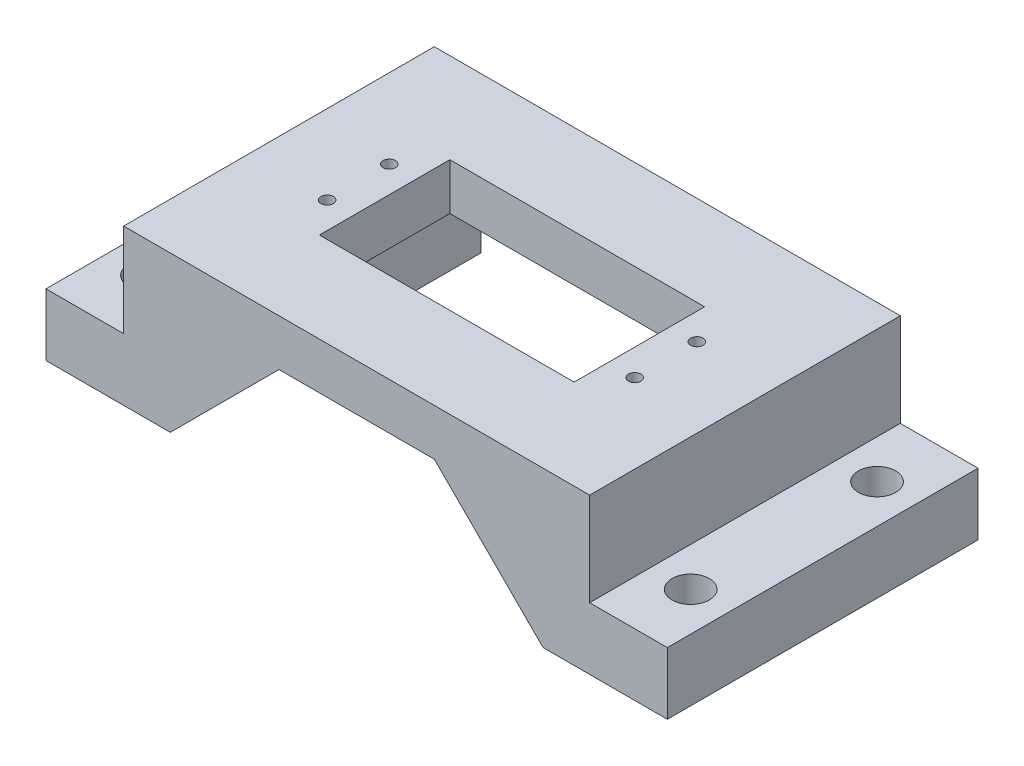
from build123d import *

# Parameters (mm, degrees)
SKETCH2_W                = 20
SKETCH2_H                = 50
BOSS_EXTRUDE2_DEPTH      = 10
BOSS_EXTRUDE2_2_DEPTH    = 10
SKETCH3_W                = 7.5
SKETCH3_H                = 50
BOSS_EXTRUDE3_DEPTH      = 15
BOSS_EXTRUDE4_REACH      = 89.464
SKETCH4_W                = 50
SKETCH4_H                = 7.5
CUT_EXTRUDE1_DEPTH       = 62.23724357
CUT_EXTRUDE1_DEPTH_BACK  = 62.23724357
SKETCH6_R                = 1
SKETCH6_W                = 41
SKETCH6_H                = 21
F_6_0_6_DIAMETER_HOLE1_D = 6
SKETCH10_W               = 20
SKETCH10_H               = 10
BOSS_EXTRUDE5_DEPTH      = 17.5
CHAMFER1_SIZE            = 20


with BuildPart() as part:
    # Sketch2 → Boss-Extrude2 (new body)
    with BuildSketch(Plane(origin=(0, 0, 0), x_dir=(1, 0, 0), z_dir=(0, 1, 0))):
        with Locations((-40, 0)):
            Rectangle(SKETCH2_W, SKETCH2_H)
    extrude(amount=BOSS_EXTRUDE2_DEPTH)



with BuildPart() as body_2:
    # Sketch2 → Boss-Extrude2 2 (new body)
    with BuildSketch(Plane(origin=(0, 0, 0), x_dir=(1, 0, 0), z_dir=(0, 1, 0))):
        with Locations((40, 0)):
            Rectangle(SKETCH2_W, SKETCH2_H)
    extrude(amount=BOSS_EXTRUDE2_2_DEPTH)


with BuildPart() as part_1:
    add(part.part)

    add(body_2.part)  # Boss-Extrude3 merges body 2
    # Sketch3 → Boss-Extrude3 (add)
    with BuildSketch(Plane(origin=(0, 10, 0), x_dir=(1, 0, 0), z_dir=(0, 1, 0))):
        with Locations((-33.75, 0)):
            Rectangle(SKETCH3_W, SKETCH3_H)
        with Locations((33.75, 0)):
            Rectangle(SKETCH3_W, SKETCH3_H)
    extrude(amount=BOSS_EXTRUDE3_DEPTH)

    # Sketch4 → Boss-Extrude4 (add, up to next)
    with BuildSketch(Plane.ZY.offset(-30), mode=Mode.PRIVATE) as boss_extrude4_sk1:
        with Locations((0, 21.25)):
            Rectangle(SKETCH4_W, SKETCH4_H)
    boss_extrude4_tool1 = extrude(boss_extrude4_sk1.sketch, amount=BOSS_EXTRUDE4_REACH, mode=Mode.PRIVATE) - part_1.part
    add(boss_extrude4_tool1.solids().sort_by_distance((30, 21.25, 0))[0])

    # Sketch6 → Cut-Extrude1 (cut, two sides: drawn at the far end of the back side and taken through both)
    with BuildSketch(Plane(origin=(0, 25, 0), x_dir=(1, 0, 0), z_dir=(0, 1, 0)).offset(-CUT_EXTRUDE1_DEPTH_BACK)):
        with Locations(Location((24.75, 5, 0), (0, 0, 270))):
            Circle(SKETCH6_R)
        with Locations(Location((24.75, -5, 0), (0, 0, 270))):
            Circle(SKETCH6_R)
        with Locations(Location((-24.75, 5, 0), (0, 0, 270))):
            Circle(SKETCH6_R)
        with Locations(Location((-24.75, -5, 0), (0, 0, 270))):
            Circle(SKETCH6_R)
        Rectangle(SKETCH6_W, SKETCH6_H)
    extrude(amount=CUT_EXTRUDE1_DEPTH + CUT_EXTRUDE1_DEPTH_BACK, mode=Mode.SUBTRACT)

    # Ø6.0 (6) Diameter Hole1 (through all)
    with Locations(Plane(origin=(-43.75, 10, -15), x_dir=(0, 0, 1), z_dir=(0, 1, 0))):
        with Locations((0, 0), (30, 0), (30, 87.5), (0, 87.5)):
            Hole(F_6_0_6_DIAMETER_HOLE1_D / 2)

    # Sketch10 → Boss-Extrude5 (add)
    with BuildSketch(Plane.XZ.offset(-17.5)):
        with Locations((-20, 20)):
            Rectangle(SKETCH10_W, SKETCH10_H)
        with Locations((20, 20)):
            Rectangle(SKETCH10_W, SKETCH10_H)
    extrude(amount=BOSS_EXTRUDE5_DEPTH)

    # Chamfer1
    # the kernel refuses this chamfer: 20 mm, written as the material it adds along each edge
    # the kernel refuses this chamfer: 20 mm, written as the material it takes off along each edge
    with BuildSketch(Plane(origin=(10, 0, 76.433659759), x_dir=(0.9996219169112968, -0.027495876610586372, 0), z_dir=(0, 0, -1))) as chamfer1_2_piece_1_section:
        Polygon((CHAMFER1_SIZE * 0.999621916911, -CHAMFER1_SIZE * 0.0274958766106), (-CHAMFER1_SIZE * 0.0274958766106, -CHAMFER1_SIZE * 0.999621916911), (0, 0), align=None)
    chamfer1_2_piece_1 = extrude(amount=112.867319519, mode=Mode.PRIVATE)
    chamfer1_2_piece_1 = split(chamfer1_2_piece_1, bisect_by=Plane(origin=(16.759259259, 17.5, 20), z_dir=(0, -1, 0)), keep=Keep.TOP, mode=Mode.PRIVATE)
    add(chamfer1_2_piece_1, mode=Mode.SUBTRACT)
    with BuildSketch(Plane(origin=(-10, 0, 76.433659759), x_dir=(0.027495876610586403, 0.9996219169112968, 0), z_dir=(0, 0, -1))) as chamfer1_2_piece_2_section:
        Polygon((CHAMFER1_SIZE * 0.999621916911, -CHAMFER1_SIZE * 0.0274958766106), (-CHAMFER1_SIZE * 0.0274958766106, -CHAMFER1_SIZE * 0.999621916911), (0, 0), align=None)
    chamfer1_2_piece_2 = extrude(amount=112.867319519, mode=Mode.PRIVATE)
    chamfer1_2_piece_2 = split(chamfer1_2_piece_2, bisect_by=Plane(origin=(-16.759259259, 17.5, 20), z_dir=(0, -1, 0)), keep=Keep.TOP, mode=Mode.PRIVATE)
    add(chamfer1_2_piece_2, mode=Mode.SUBTRACT)


solid = part_1.part
